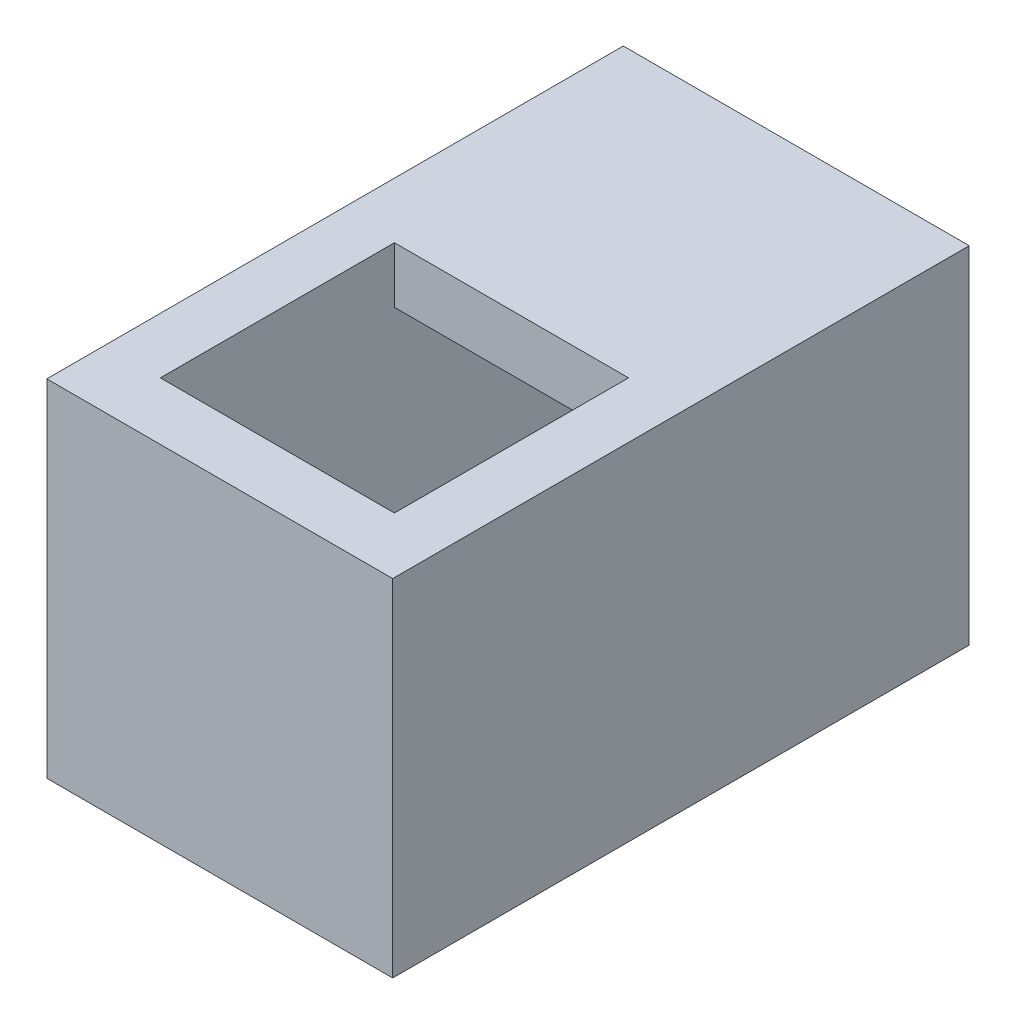
from build123d import *

# Parameters (mm, degrees)
SKETCH1_W           = 30
SKETCH1_H           = 30
BOSS_EXTRUDE1_DEPTH = 50
SKETCH3_W           = 20.3
SKETCH3_H           = 20.3
CUT_EXTRUDE1_DEPTH  = 66.574385243
SKETCH2_W           = 20.3
SKETCH2_H           = 20.3
CUT_EXTRUDE2_DEPTH  = 30


with BuildPart() as part:
    # Sketch1 → Boss-Extrude1 (new body)
    with BuildSketch(Plane.XY):
        with Locations((15, 15)):
            Rectangle(SKETCH1_W, SKETCH1_H)
    extrude(amount=BOSS_EXTRUDE1_DEPTH)

    # Sketch3 → Cut-Extrude1 (cut, through all)
    with BuildSketch(Plane(origin=(0, 30, 0), x_dir=(1, 0, 0), z_dir=(0, 1, 0))):
        with Locations((15, -34.85)):
            Rectangle(SKETCH3_W, SKETCH3_H)
    extrude(amount=-CUT_EXTRUDE1_DEPTH, mode=Mode.SUBTRACT)

    # Sketch2 → Cut-Extrude2 (cut)
    with BuildSketch(Plane(origin=(0, 0, 0), x_dir=(-1, 0, 0), z_dir=(0, 0, -1))):
        with Locations((-15, 15)):
            Rectangle(SKETCH2_W, SKETCH2_H)
    extrude(amount=-CUT_EXTRUDE2_DEPTH, mode=Mode.SUBTRACT)


solid = part.part
